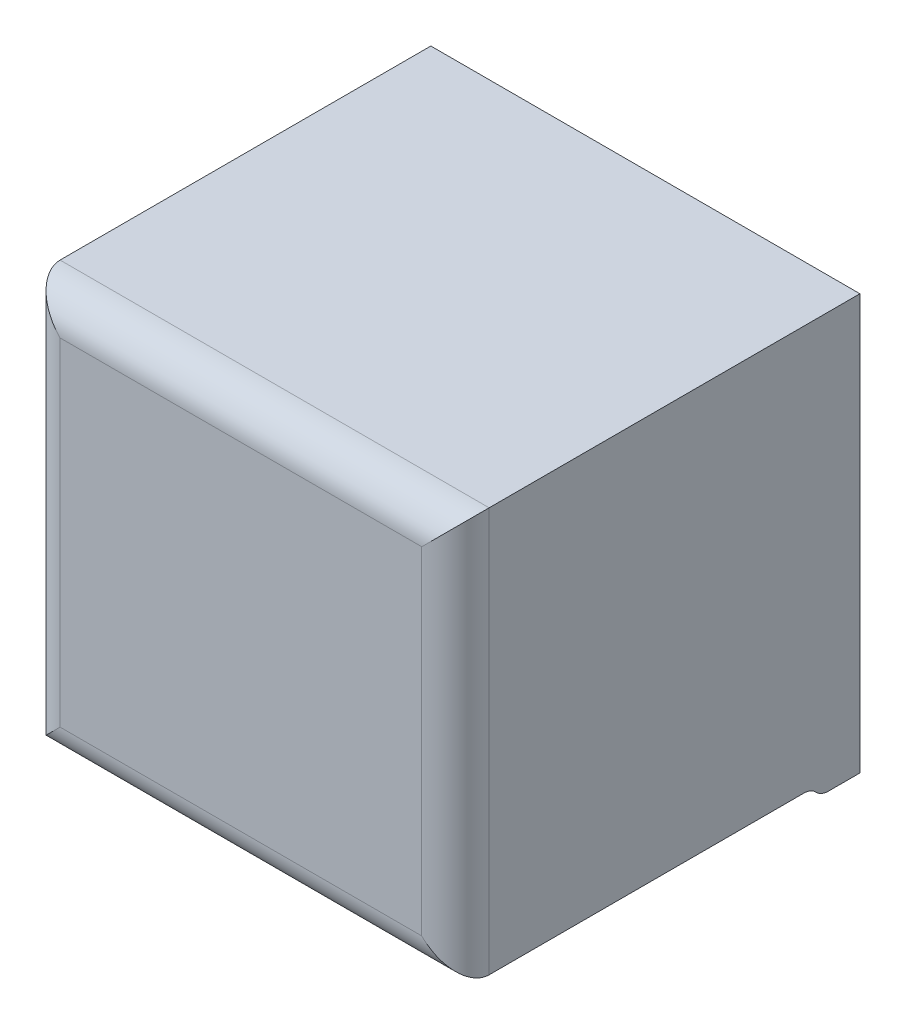
from build123d import *

# Parameters (mm, degrees)
BOSS_EXTRUDE1_DEPTH     = 120
FILLET1_R               = 10
SHELL3_T                = -5
SKETCH3_R               = 1.7000000000000046
SKETCH3_R_2             = 1.6999999999999973
SKETCH3_R_3             = 1.6999999999999988
SKETCH3_R_4             = 1.7000000000000004
BOSS_EXTRUDE3_DEPTH     = 20
CUT_EXTRUDE1_DEPTH      = 213.14450263912096
CUT_EXTRUDE1_DEPTH_BACK = 20
SKETCH2_R               = 1.6999999999999973
SKETCH2_R_2             = 1.7000000000000024
SKETCH2_R_3             = 1.6999999999999988
SKETCH2_R_4             = 1.7000000000000004
FILLET5_R               = 5
SKETCH4_W               = 11.999999999999972
SKETCH4_H               = 11.999999999999998
CUT_EXTRUDE2_DEPTH      = 11.000000000000004
BOSS_EXTRUDE4_DEPTH     = 3.14
FILLET6_R               = 5
FILLET7_R               = 5
CUT_EXTRUDE3_DEPTH      = 13.140000000000002


# Some blends are built 0.0001 mm under size
with BuildPart() as part:
    # Sketch1 → Boss-Extrude1 (new body)
    with BuildSketch(Plane.XY):
        Polygon((0, 0), (-127.3, 0), (-127.29999999999997, -120.00000000000001), (0, -120.00000000000001), align=None)
    extrude(amount=BOSS_EXTRUDE1_DEPTH)

    # Fillet1
    fillet1_edges = [part.edges().sort_by_distance(p)[0] for p in [
        (-127.29999999999998, -60.00000000000001, 120),
        (-63.649999999999984, -120.00000000000001, 120),
        (0, -60.00000000000001, 120),
        (-63.65, 0, 120),
    ]]
    fillet(fillet1_edges, radius=FILLET1_R)

    # Shell3
    shell3_openings = [part.faces().sort_by_distance(p)[0] for p in [
        (-63.65, -60, 0),
    ]]
    offset(amount=SHELL3_T, openings=shell3_openings)

    # Sketch3 → Boss-Extrude3 (add)
    # profile 1 of 4: a face of its own
    with BuildSketch(Plane(origin=(0, 0, 0), x_dir=(-1, 0, 0), z_dir=(0, 0, -1))):
        Polygon((10.00000000000002, -110.00000000000004), (10.000000000000023, -120.00000000000006), (0, -120.00000000000003), (3.816e-14, -110.00000000000006), align=None)
        with Locations((5, -115.28672427337001)):
            Circle(SKETCH3_R, mode=Mode.SUBTRACT)
    # profile 2 of 4: a face of its own
    with BuildSketch(Plane(origin=(0, 0, 0), x_dir=(-1, 0, 0), z_dir=(0, 0, -1))):
        Polygon((117.30000000000004, -109.99999999999997), (117.30000000000007, -119.99999999999997), (127.29999999999997, -120.00000000000001), (127.30000000000005, -109.99999999999996), align=None)
        with Locations((122.3, -115.28672427337001)):
            Circle(SKETCH3_R_2, mode=Mode.SUBTRACT)
    # profile 3 of 4: a face of its own
    with BuildSketch(Plane(origin=(0, 0, 0), x_dir=(-1, 0, 0), z_dir=(0, 0, -1))):
        Polygon((127.3, -10.000000000000007), (117.30000000000001, -10.000000000000007), (117.30000000000001, -1.241e-14), (127.3, 0), align=None)
        with Locations((122.3, -4.713275726630009)):
            Circle(SKETCH3_R_3, mode=Mode.SUBTRACT)
    # profile 4 of 4: a face of its own
    with BuildSketch(Plane(origin=(0, 0, 0), x_dir=(-1, 0, 0), z_dir=(0, 0, -1))):
        Polygon((9.99999999999998, -10), (9.999999999999977, 0), (0, 0), (0, -10), align=None)
        with Locations((4.999999999999997, -4.713275726630009)):
            Circle(SKETCH3_R_4, mode=Mode.SUBTRACT)
    extrude(amount=-BOSS_EXTRUDE3_DEPTH)

    # Sketch2 → Cut-Extrude1 (cut, two sides: drawn at the far end of the back side and taken through both)
    with BuildSketch(Plane(origin=(0, 0, 0), x_dir=(-1, 0, 0), z_dir=(0, 0, -1)).offset(-CUT_EXTRUDE1_DEPTH_BACK)):
        with Locations(Location((122.3, -115.28672427337001, 0), (0, 0, 90))):
            Circle(SKETCH2_R)
        with Locations(Location((5, -115.28672427337001, 0), (0, 0, 90))):
            Circle(SKETCH2_R_2)
        with Locations(Location((122.3, -4.713275726630009, 0), (0, 0, 270))):
            Circle(SKETCH2_R_3)
        with Locations(Location((4.999999999999997, -4.713275726630009, 0), (0, 0, 270))):
            Circle(SKETCH2_R_4)
    extrude(amount=CUT_EXTRUDE1_DEPTH + CUT_EXTRUDE1_DEPTH_BACK, mode=Mode.SUBTRACT)

    # Fillet5
    fillet5_edges = [part.edges().sort_by_distance(p)[0] for p in [
        (-117.30000000000004, -109.99999999999997, 10),
        (-10.00000000000002, -110.00000000000004, 10),
        (-117.30000000000001, -10.000000000000007, 10),
        (-9.99999999999998, -10, 10),
    ]]
    fillet(fillet5_edges, radius=FILLET5_R - 0.0001)  # a hair under: the kernel refuses the full size

    # Sketch4 → Cut-Extrude2 (cut)
    with BuildSketch(Plane.XZ.offset(120.00000000000001)):
        with Locations((-110.29999999999995, 19.000000000000004)):
            Rectangle(SKETCH4_W, SKETCH4_H)
    extrude(amount=-CUT_EXTRUDE2_DEPTH, mode=Mode.SUBTRACT)

    # Sketch5 → Boss-Extrude4 (add)
    with BuildSketch(Plane.XZ.offset(120.00000000000001)):
        Polygon((-127.29999999999997, 0), (-127.29999999999997, 12), (0, 11.999999999999996), (0, 0), align=None)
    extrude(amount=BOSS_EXTRUDE4_DEPTH)

    # Fillet6
    # the kernel refuses this fillet: 5 mm, written as the material it adds along each edge
    with BuildSketch(Plane(origin=(-127.29999999999997, -120.00000000000001, 12), x_dir=(0, -1, 0), z_dir=(1, 0, -3e-17))) as fillet6_piece_1_section:
        with BuildLine():
            CenterArc((5, -4.6411636471902185), FILLET6_R, 111.83901544841774, 68.16098455158226)
            Line((0, -4.6411636471902185), (-0.09999999999999432, -4.6411636471902185))
            Line((-0.09999999999999432, -4.6411636471902185), (-0.09999999999999432, 0))
            Line((-0.09999999999999432, 0), (0, 0.09999999999999964))
            ThreePointArc((0, 0.09999999999999964), (1.5700000000000074, 0.09999999999999964), (3.102800000000002, 0.09282327294380366))
            Line((3.102800000000002, 0.09282327294380366), (3.1400000000000006, 0))
        make_face()
    fillet6_piece_1 = extrude(amount=127.29999999999997, mode=Mode.PRIVATE)
    fillet6_piece_1 = split(fillet6_piece_1, bisect_by=Plane(origin=(-116.29999999999995, -121.1633004902019, 12.387505999299782), z_dir=(-1, 0, 0)), keep=Keep.TOP, mode=Mode.PRIVATE)
    fillet6_piece_1 = split(fillet6_piece_1, bisect_by=Plane(origin=(-121.79999999999993, -121.1633004902019, 13.000000000000005), z_dir=(0, 0, -1)), keep=Keep.TOP, mode=Mode.PRIVATE)
    add(fillet6_piece_1)
    with BuildSketch(Plane(origin=(-127.29999999999997, -120.00000000000001, 12), x_dir=(0, -1, 0), z_dir=(1, 0, -3e-17))) as fillet6_piece_2_section:
        with BuildLine():
            CenterArc((5, -4.6411636471902185), FILLET6_R, 111.83901544841774, 68.16098455158226)
            Line((0, -4.6411636471902185), (-0.09999999999999432, -4.6411636471902185))
            Line((-0.09999999999999432, -4.6411636471902185), (-0.09999999999999432, 0))
            Line((-0.09999999999999432, 0), (0, 0.09999999999999964))
            ThreePointArc((0, 0.09999999999999964), (1.5700000000000074, 0.09999999999999964), (3.102800000000002, 0.09282327294380366))
            Line((3.102800000000002, 0.09282327294380366), (3.1400000000000006, 0))
        make_face()
    fillet6_piece_2 = extrude(amount=127.29999999999997, mode=Mode.PRIVATE)
    fillet6_piece_2 = split(fillet6_piece_2, bisect_by=Plane(origin=(-116.29999999999995, -120.36954878500708, 14.03973885667022), z_dir=(-1, 0, 0)), keep=Keep.TOP, mode=Mode.PRIVATE)
    fillet6_piece_2 = split(fillet6_piece_2, bisect_by=Plane(origin=(-121.79999999999998, -120.36954878500708, 13.000000000000005), z_dir=(0, 0, 1)), keep=Keep.TOP, mode=Mode.PRIVATE)
    add(fillet6_piece_2)
    with BuildSketch(Plane(origin=(-127.29999999999997, -120.00000000000001, 12), x_dir=(0, -1, 0), z_dir=(1, 0, -3e-17))) as fillet6_piece_3_section:
        with BuildLine():
            CenterArc((5, -4.6411636471902185), FILLET6_R, 111.83901544841774, 68.16098455158226)
            Line((0, -4.6411636471902185), (-0.09999999999999432, -4.6411636471902185))
            Line((-0.09999999999999432, -4.6411636471902185), (-0.09999999999999432, 0))
            Line((-0.09999999999999432, 0), (0, 0.09999999999999964))
            ThreePointArc((0, 0.09999999999999964), (1.5700000000000074, 0.09999999999999964), (3.102800000000002, 0.09282327294380366))
            Line((3.102800000000002, 0.09282327294380366), (3.1400000000000006, 0))
        make_face()
    fillet6_piece_3 = extrude(amount=127.29999999999997, mode=Mode.PRIVATE)
    fillet6_piece_3 = split(fillet6_piece_3, bisect_by=Plane(origin=(-116.29999999999995, -121.16330049020192, 12.387505999299782), z_dir=(1, 0, 0)), keep=Keep.TOP, mode=Mode.PRIVATE)
    fillet6_piece_3 = split(fillet6_piece_3, bisect_by=Plane(origin=(-110.29999999999997, -121.16330049020192, 13.000000000000005), z_dir=(0, 0, -1)), keep=Keep.TOP, mode=Mode.PRIVATE)
    fillet6_piece_3 = split(fillet6_piece_3, bisect_by=Plane(origin=(-104.29999999999997, -121.16330049020192, 12.387505999299782), z_dir=(-1, 0, 0)), keep=Keep.TOP, mode=Mode.PRIVATE)
    add(fillet6_piece_3)
    with BuildSketch(Plane(origin=(-127.29999999999997, -120.00000000000001, 12), x_dir=(0, -1, 0), z_dir=(1, 0, -3e-17))) as fillet6_piece_4_section:
        with BuildLine():
            CenterArc((5, -4.6411636471902185), FILLET6_R, 111.83901544841774, 68.16098455158226)
            Line((0, -4.6411636471902185), (-0.09999999999999432, -4.6411636471902185))
            Line((-0.09999999999999432, -4.6411636471902185), (-0.09999999999999432, 0))
            Line((-0.09999999999999432, 0), (0, 0.09999999999999964))
            ThreePointArc((0, 0.09999999999999964), (1.5700000000000074, 0.09999999999999964), (3.102800000000002, 0.09282327294380366))
            Line((3.102800000000002, 0.09282327294380366), (3.1400000000000006, 0))
        make_face()
    fillet6_piece_4 = extrude(amount=127.29999999999997, mode=Mode.PRIVATE)
    fillet6_piece_4 = split(fillet6_piece_4, bisect_by=Plane(origin=(-52.149999999999835, -121.16330049020192, 13.000000000000005), z_dir=(0, 0, -1)), keep=Keep.TOP, mode=Mode.PRIVATE)
    fillet6_piece_4 = split(fillet6_piece_4, bisect_by=Plane(origin=(-104.29999999999997, -121.16330049020192, 12.387505999299783), z_dir=(1, 0, 0)), keep=Keep.TOP, mode=Mode.PRIVATE)
    add(fillet6_piece_4)
    with BuildSketch(Plane(origin=(-127.29999999999997, -120.00000000000001, 12), x_dir=(0, -1, 0), z_dir=(1, 0, -3e-17))) as fillet6_piece_5_section:
        with BuildLine():
            CenterArc((5, -4.6411636471902185), FILLET6_R, 111.83901544841774, 68.16098455158226)
            Line((0, -4.6411636471902185), (-0.09999999999999432, -4.6411636471902185))
            Line((-0.09999999999999432, -4.6411636471902185), (-0.09999999999999432, 0))
            Line((-0.09999999999999432, 0), (0, 0.09999999999999964))
            ThreePointArc((0, 0.09999999999999964), (1.5700000000000074, 0.09999999999999964), (3.102800000000002, 0.09282327294380366))
            Line((3.102800000000002, 0.09282327294380366), (3.1400000000000006, 0))
        make_face()
    fillet6_piece_5 = extrude(amount=127.29999999999997, mode=Mode.PRIVATE)
    fillet6_piece_5 = split(fillet6_piece_5, bisect_by=Plane(origin=(-52.14999999999998, -120.36954878500707, 13.000000000000005), z_dir=(0, 0, 1)), keep=Keep.TOP, mode=Mode.PRIVATE)
    fillet6_piece_5 = split(fillet6_piece_5, bisect_by=Plane(origin=(-104.29999999999997, -120.36954878500707, 14.03973885667022), z_dir=(1, 0, 0)), keep=Keep.TOP, mode=Mode.PRIVATE)
    add(fillet6_piece_5)

    # Fillet7
    # the kernel refuses this fillet: 5 mm, written as the material it takes off along each edge
    with BuildSketch(Plane(origin=(-133.88712936466723, -123.14000000000001, 11.999999999999773), x_dir=(0, 0.8426718111972903, 0.5384275425844023), z_dir=(1, 0, -1e-17))) as fillet7_piece_1:
        with BuildLine():
            CenterArc((2.794682305385189, -4.912453005847793), FILLET7_R, 100.73764343311844, 46.68569768534586)
            Line((-1.4186767506012903, -2.2203152929258243), (0, 0))
            ThreePointArc((0, 0), (0.93156076846174, -0.08754699415221018), (1.8631215369234693, -9e-17))
        make_face()
    extrude(amount=140.47425872933445, mode=Mode.SUBTRACT)

    # Sketch6 → Cut-Extrude3 (cut)
    with BuildSketch(Plane.XZ.offset(123.14000000000001)):
        with BuildLine():
            Line((-78.64999999999999, -2.6e-15), (-73.64999999999999, -2.17e-15))
            Line((-73.64999999999999, -2.01e-15), (-53.65, 0))
            Line((-53.65, -4.3e-16), (-48.65, 0))
            ThreePointArc((-48.65, 8.9e-16), (-52.185533905932736, 1.4644660940672627), (-53.65, 5))
            Line((-53.65, 5), (-53.65, 9.365148254133372))
            Line((-53.65, 9.365148254133372), (-73.64999999999999, 9.365148254133372))
            Line((-73.64999999999999, 9.365148254133372), (-73.64999999999999, 4.999999999999997))
            ThreePointArc((-73.64999999999999, 4.999999999999997), (-75.11446609406725, 1.4644660940672605), (-78.64999999999999, -1.78e-15))
        make_face()
        with BuildLine():
            Line((-73.64999999999999, 30.000000000000004), (-73.64999999999999, 9.365148254133372))
            Line((-73.64999999999999, 9.365148254133372), (-53.65, 9.365148254133372))
            Line((-53.65, 9.365148254133372), (-53.65, 30.000000000000007))
            ThreePointArc((-53.65, 30.000000000000004), (-55.114466094067254, 33.53553390593274), (-58.64999999999999, 35))
            Line((-58.64999999999999, 35), (-68.64999999999999, 35))
            ThreePointArc((-68.64999999999999, 35), (-72.18553390593273, 33.53553390593274), (-73.64999999999999, 30.000000000000004))
        make_face()
        with BuildLine():
            Line((-73.89999999999999, 9.365148254133372), (-73.64999999999999, 9.365148254133372))
            Line((-73.64999999999999, 9.365148254133372), (-73.64999999999999, 30.000000000000004))
            ThreePointArc((-73.64999999999999, 30.000000000000004), (-72.18553390593273, 33.53553390593274), (-68.64999999999999, 35))
            Line((-68.64999999999999, 35), (-58.64999999999999, 35))
            ThreePointArc((-58.64999999999999, 35), (-55.114466094067254, 33.53553390593274), (-53.65, 30.000000000000004))
            Line((-53.65, 30.000000000000007), (-53.65, 9.365148254133372))
            Line((-53.65, 9.365148254133372), (-53.4, 9.365148254133372))
            Line((-53.4, 9.365148254133372), (-53.4, 30.000000000000004))
            ThreePointArc((-53.4, 30.000000000000004), (-54.93768939877062, 33.712310601229376), (-58.64999999999999, 35.25))
            Line((-58.64999999999999, 35.25), (-68.64999999999999, 35.25))
            ThreePointArc((-68.64999999999999, 35.25), (-72.36231060122937, 33.712310601229376), (-73.89999999999999, 30.000000000000004))
            Line((-73.89999999999999, 30.000000000000004), (-73.89999999999999, 9.365148254133372))
        make_face()
        with BuildLine():
            ThreePointArc((-53.65, 5), (-52.185533905932736, 1.4644660940672627), (-48.65, 8.9e-16))
            Line((-48.65, 0), (-48.65, 0.25000000000000455))
            ThreePointArc((-48.65, 0.2500000000000062), (-52.0087572106361, 1.6412427893639014), (-53.4, 5.000000000000001))
            Line((-53.4, 5.000000000000001), (-53.4, 9.365148254133372))
            Line((-53.4, 9.365148254133372), (-53.65, 9.365148254133372))
            Line((-53.65, 9.365148254133372), (-53.65, 5))
        make_face()
        with BuildLine():
            Line((-78.64999999999999, 0.249999999999995), (-78.64999999999999, -2.61e-15))
            ThreePointArc((-78.64999999999999, -1.78e-15), (-75.11446609406725, 1.4644660940672605), (-73.64999999999999, 4.999999999999997))
            Line((-73.64999999999999, 4.999999999999997), (-73.64999999999999, 9.365148254133372))
            Line((-73.64999999999999, 9.365148254133372), (-73.89999999999999, 9.365148254133372))
            Line((-73.89999999999999, 9.365148254133372), (-73.89999999999999, 4.999999999999997))
            ThreePointArc((-73.89999999999999, 4.999999999999997), (-75.29124278936389, 1.641242789363897), (-78.64999999999999, 0.24999999999999112))
        make_face()
    extrude(amount=-CUT_EXTRUDE3_DEPTH, mode=Mode.SUBTRACT)


solid = part.part
